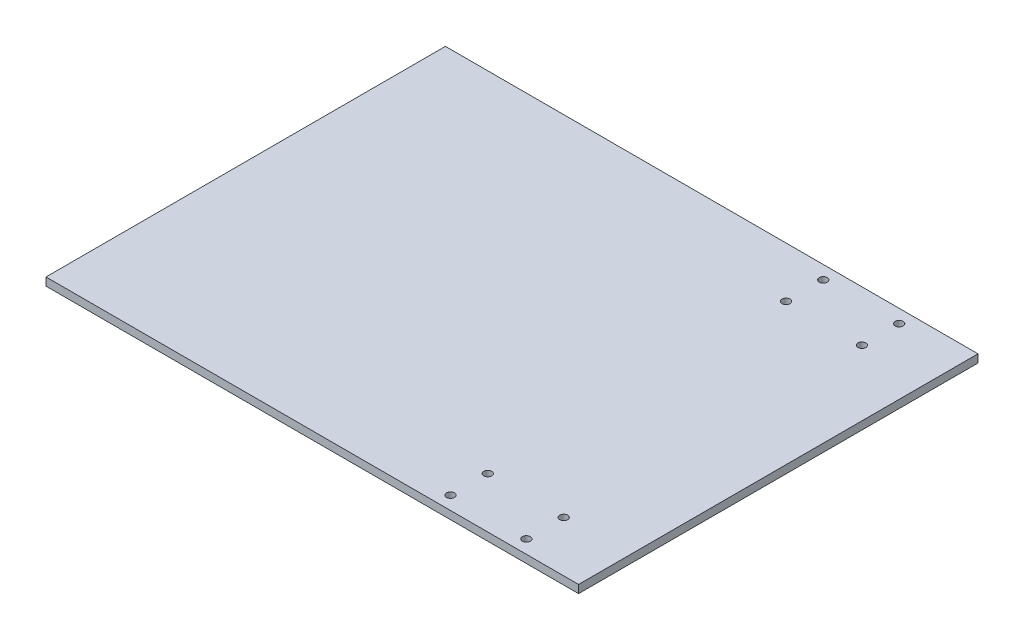
from build123d import *

# Parameters (mm, degrees)
SKETCH2_W           = 200
SKETCH2_H           = 150
BOSS_EXTRUDE1_DEPTH = 3
SKETCH3_R           = 1.5
CUT_EXTRUDE1_DEPTH  = 251.017999352


with BuildPart() as part:
    # Sketch2 → Boss-Extrude1 (new body)
    with BuildSketch(Plane(origin=(0, 0, 0), x_dir=(1, 0, 0), z_dir=(0, 1, 0))):
        with Locations((100, 75)):
            Rectangle(SKETCH2_W, SKETCH2_H)
    extrude(amount=BOSS_EXTRUDE1_DEPTH)

    # Sketch3 → Cut-Extrude1 (cut, through all)
    with BuildSketch(Plane(origin=(0, 3, 0), x_dir=(1, 0, 0), z_dir=(0, 1, 0))):
        with Locations((175.4, 145)):
            Circle(SKETCH3_R)
        with Locations((146.9, 145)):
            Circle(SKETCH3_R)
        with Locations((175.4, 131)):
            Circle(SKETCH3_R)
        with Locations((146.9, 131)):
            Circle(SKETCH3_R)
        with Locations((175.4, 19)):
            Circle(SKETCH3_R)
        with Locations((175.4, 5)):
            Circle(SKETCH3_R)
        with Locations((146.9, 5)):
            Circle(SKETCH3_R)
        with Locations((146.9, 19)):
            Circle(SKETCH3_R)
    extrude(amount=-CUT_EXTRUDE1_DEPTH, mode=Mode.SUBTRACT)


solid = part.part
